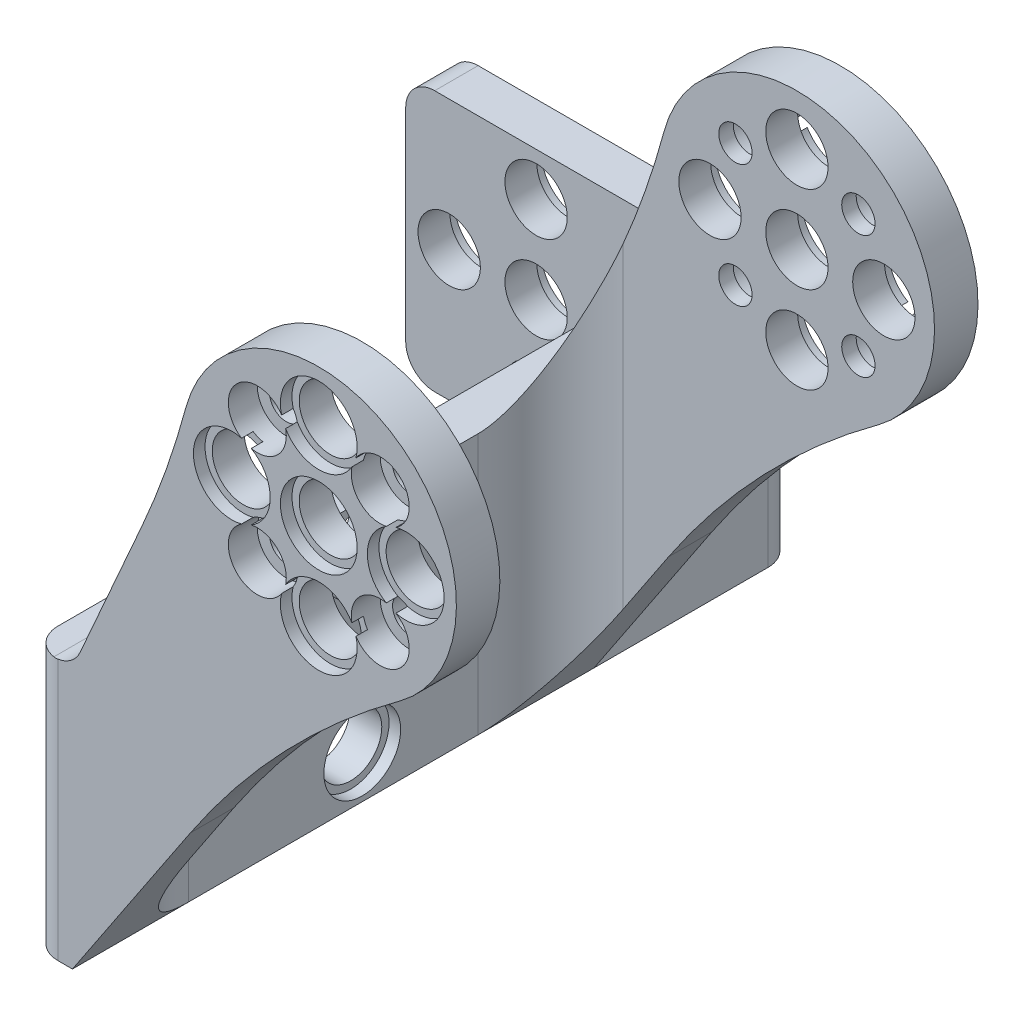
from build123d import *

# Parameters (mm, degrees)
SKETCH1_R                                            = 2
BOSS_EXTRUDE1_DEPTH                                  = 3
SKETCH23_R                                           = 2.15
CUT_EXTRUDE5_DEPTH                                   = 41.422765863
SKETCH2_W                                            = 3
SKETCH2_H                                            = 18
BOSS_EXTRUDE2_DEPTH                                  = 44
SKETCH3_R                                            = 2.15
BOSS_EXTRUDE3_DEPTH                                  = 3
SKETCH5_R                                            = 2.65
CUT_EXTRUDE1_DEPTH                                   = 0.8
CUT_EXTRUDE2_START                                   = -0.8
SKETCH11_R                                           = 2.65
CUT_EXTRUDE2_DEPTH                                   = 0.8
SKETCH12_W                                           = 24
SKETCH12_H                                           = 18
SKETCH12_R                                           = 2
BOSS_EXTRUDE4_DEPTH                                  = 3
SKETCH24_R                                           = 2.15
CUT_EXTRUDE6_DEPTH                                   = 74.525505779
HOLE1_D                                              = 4.3
HOLE1_CBORE_D                                        = 5.3
HOLE1_CBORE_DEPTH                                    = 0.8
SKETCH22_R                                           = 2.65
CUT_EXTRUDE4_DEPTH                                   = 0.8
CBORE_FOR_M1_6_HEX_SOCKET_HEAD_CAP_SCREW_D           = 2.3
CBORE_FOR_M1_6_HEX_SOCKET_HEAD_CAP_SCREW_DEPTH       = 3
CBORE_FOR_M1_6_HEX_SOCKET_HEAD_CAP_SCREW_CBORE_D     = 4
CBORE_FOR_M1_6_HEX_SOCKET_HEAD_CAP_SCREW_CBORE_DEPTH = 2
CBORE_FOR_M1_6_HEX_SOCKET_HEAD_CAP_S_2_D             = 2.3
CBORE_FOR_M1_6_HEX_SOCKET_HEAD_CAP_S_2_CBORE_D       = 4
CBORE_FOR_M1_6_HEX_SOCKET_HEAD_CAP_S_2_CBORE_DEPTH   = 2
HOLE2_D                                              = 4.3
HOLE2_DEPTH                                          = 3
HOLE2_CBORE_D                                        = 5.3
HOLE2_CBORE_DEPTH                                    = 0.8
HOLE3_D                                              = 4.3
HOLE3_CBORE_D                                        = 5.3
HOLE3_CBORE_DEPTH                                    = 0.8
FILLET10_R                                           = 2
FILLET5_R                                            = 2
CHAMFER2_SIZE                                        = 2
FILLET7_R                                            = 60
REDONDEO1_R                                          = 5


with BuildPart() as part:
    # Sketch1 → Boss-Extrude1 (new body)
    with BuildSketch(Plane.XY):
        with BuildLine():
            Line((0, -9.5), (-17, -35))
            Line((-17, -35), (-20, -35))
            Line((-20, -35), (-20, -17))
            Line((-20, -17), (-17, -17))
            Line((-17, -17), (-9.5, 0))
            ThreePointArc((-9.5, 0), (6.717514421, 6.717514421), (0, -9.5))
        make_face()
        with Locations((-6, 0)):
            Circle(SKETCH1_R, mode=Mode.SUBTRACT)
        with Locations((0, -6)):
            Circle(SKETCH1_R, mode=Mode.SUBTRACT)
        with Locations((6, 0)):
            Circle(SKETCH1_R, mode=Mode.SUBTRACT)
        with Locations((0, 6)):
            Circle(SKETCH1_R, mode=Mode.SUBTRACT)
    extrude(amount=BOSS_EXTRUDE1_DEPTH)

    # Sketch23 → Cut-Extrude5 (cut, through all)
    with BuildSketch(Plane.XY.offset(3)):
        with Locations((6, 0)):
            Circle(SKETCH23_R)
        with Locations((0, -6)):
            Circle(SKETCH23_R)
        with Locations((-6, 0)):
            Circle(SKETCH23_R)
        with Locations((0, 6)):
            Circle(SKETCH23_R)
    extrude(amount=-CUT_EXTRUDE5_DEPTH, mode=Mode.SUBTRACT)

    # Sketch2 → Boss-Extrude2 (add)
    with BuildSketch(Plane(origin=(0, 0, 0), x_dir=(-1, 0, 0), z_dir=(0, 0, -1))):
        with Locations((18.5, -26)):
            Rectangle(SKETCH2_W, SKETCH2_H)
    extrude(amount=BOSS_EXTRUDE2_DEPTH)

    # Sketch3 → Boss-Extrude3 (add)
    with BuildSketch(Plane(origin=(0, 0, -30), x_dir=(-1, 0, 0), z_dir=(0, 0, -1))):
        with BuildLine():
            Line((20, -17), (17, -17))
            Line((17, -17), (9.5, 0))
            ThreePointArc((9.5, 0), (-6.717514421, 6.717514421), (0, -9.5))
            Line((0, -9.5), (17, -35))
            Line((17, -35), (20, -35))
            Line((20, -35), (20, -17))
        make_face()
        with Locations(Location((0, -6, 0), (0, 0, 180))):
            Circle(SKETCH3_R, mode=Mode.SUBTRACT)
        with Locations(Location((-6, 0, 0), (0, 0, 180))):
            Circle(SKETCH3_R, mode=Mode.SUBTRACT)
        with Locations(Location((6, 0, 0), (0, 0, 180))):
            Circle(SKETCH3_R, mode=Mode.SUBTRACT)
        with Locations(Location((0, 6, 0), (0, 0, 180))):
            Circle(SKETCH3_R, mode=Mode.SUBTRACT)
    extrude(amount=BOSS_EXTRUDE3_DEPTH)

    # Sketch5 → Cut-Extrude1 (cut)
    with BuildSketch(Plane.XY.offset(3)):
        with Locations((0, -6)):
            Circle(SKETCH5_R)
        with Locations((-6, 0)):
            Circle(SKETCH5_R)
        with Locations((0, 6)):
            Circle(SKETCH5_R)
        with Locations((6, 0)):
            Circle(SKETCH5_R)
    extrude(amount=-CUT_EXTRUDE1_DEPTH, mode=Mode.SUBTRACT)

    # Sketch11 → Cut-Extrude2 (cut)
    with BuildSketch(Plane(origin=(0, 0, -33), x_dir=(-1, 0, 0), z_dir=(0, 0, -1)).offset(CUT_EXTRUDE2_START)):
        with Locations(Location((0, 6, 0), (0, 0, 180))):
            Circle(SKETCH11_R)
        with Locations(Location((-6, 0, 0), (0, 0, 180))):
            Circle(SKETCH11_R)
        with Locations(Location((0, -6, 0), (0, 0, 180))):
            Circle(SKETCH11_R)
        with Locations(Location((6, 0, 0), (0, 0, 180))):
            Circle(SKETCH11_R)
    extrude(amount=CUT_EXTRUDE2_DEPTH, mode=Mode.SUBTRACT)

    # Sketch12 → Boss-Extrude4 (add)
    with BuildSketch(Plane(origin=(0, 0, -44), x_dir=(-1, 0, 0), z_dir=(0, 0, -1))):
        with Locations((29, -26)):
            Rectangle(SKETCH12_W, SKETCH12_H)
        with Locations((38, -26)):
            Circle(SKETCH12_R, mode=Mode.SUBTRACT)
        with Locations((32, -32)):
            Circle(SKETCH12_R, mode=Mode.SUBTRACT)
        with Locations((32, -26)):
            Circle(SKETCH12_R, mode=Mode.SUBTRACT)
        with Locations((32, -20)):
            Circle(SKETCH12_R, mode=Mode.SUBTRACT)
        with Locations((26, -26)):
            Circle(SKETCH12_R, mode=Mode.SUBTRACT)
    extrude(amount=BOSS_EXTRUDE4_DEPTH)

    # Sketch24 → Cut-Extrude6 (cut, through all)
    with BuildSketch(Plane(origin=(0, 0, -47), x_dir=(-1, 0, 0), z_dir=(0, 0, -1))):
        with Locations((32, -20)):
            Circle(SKETCH24_R)
        with Locations((26, -26)):
            Circle(SKETCH24_R)
        with Locations((32, -26)):
            Circle(SKETCH24_R)
        with Locations((38, -26)):
            Circle(SKETCH24_R)
        with Locations((32, -32)):
            Circle(SKETCH24_R)
    extrude(amount=-CUT_EXTRUDE6_DEPTH, mode=Mode.SUBTRACT)

    # Hole1 (through all)
    with Locations(Plane(origin=(-17, 0, 0), x_dir=(0, 0, -1), z_dir=(1, 0, 0))):
        with Locations((17, -20), (17, -32)):
            CounterBoreHole(HOLE1_D / 2, HOLE1_CBORE_D / 2, HOLE1_CBORE_DEPTH)

    # Sketch22 → Cut-Extrude4 (cut)
    with BuildSketch(Plane(origin=(0, 0, -47), x_dir=(-1, 0, 0), z_dir=(0, 0, -1))):
        with Locations((32, -32)):
            Circle(SKETCH22_R)
        with Locations((38, -26)):
            Circle(SKETCH22_R)
        with Locations((32, -26)):
            Circle(SKETCH22_R)
        with Locations((32, -20)):
            Circle(SKETCH22_R)
        with Locations((26, -26)):
            Circle(SKETCH22_R)
    extrude(amount=-CUT_EXTRUDE4_DEPTH, mode=Mode.SUBTRACT)

    # CBORE for M1.6 Hex Socket Head Cap Screw
    with Locations(Plane.XY.offset(3)):
        with Locations((-4.242640687, -4.242640687), (4.242640687, -4.242640687), (4.242640687, 4.242640687), (-4.242640687, 4.242640687)):
            CounterBoreHole(CBORE_FOR_M1_6_HEX_SOCKET_HEAD_CAP_SCREW_D / 2, CBORE_FOR_M1_6_HEX_SOCKET_HEAD_CAP_SCREW_CBORE_D / 2, CBORE_FOR_M1_6_HEX_SOCKET_HEAD_CAP_SCREW_CBORE_DEPTH, depth=CBORE_FOR_M1_6_HEX_SOCKET_HEAD_CAP_SCREW_DEPTH)

    # CBORE for M1.6 Hex Socket Head Cap S 2 (through all)
    with Locations(Plane(origin=(0, 0, -33), x_dir=(-1, 0, 0), z_dir=(0, 0, -1))):
        with Locations((4.242640687, 4.242640687), (4.242640687, -4.242640687), (-4.242640687, -4.242640687), (-4.242640687, 4.242640687)):
            CounterBoreHole(CBORE_FOR_M1_6_HEX_SOCKET_HEAD_CAP_S_2_D / 2, CBORE_FOR_M1_6_HEX_SOCKET_HEAD_CAP_S_2_CBORE_D / 2, CBORE_FOR_M1_6_HEX_SOCKET_HEAD_CAP_S_2_CBORE_DEPTH)

    # Hole2
    with Locations(Plane.XY.offset(3)):
        with Locations((0, 0)):
            CounterBoreHole(HOLE2_D / 2, HOLE2_CBORE_D / 2, HOLE2_CBORE_DEPTH, depth=HOLE2_DEPTH)

    # Hole3 (through all)
    with Locations(Plane(origin=(0, 0, -33), x_dir=(-1, 0, 0), z_dir=(0, 0, -1))):
        with Locations((0, 0)):
            CounterBoreHole(HOLE3_D / 2, HOLE3_CBORE_D / 2, HOLE3_CBORE_DEPTH)

    # Fillet10
    fillet10_edges = [part.edges().sort_by_distance(p)[0] for p in [
        (-17, -17, 1.5),
    ]]
    fillet(fillet10_edges, radius=FILLET10_R)

    # Fillet5
    fillet5_edges = [part.edges().sort_by_distance(p)[0] for p in [
        (-41, -17, -45.5),
        (-41, -35, -45.5),
        (-17, -26, -47),
        (-20, -26, 3),
    ]]
    fillet(fillet5_edges, radius=FILLET5_R)

    # Chamfer2
    chamfer2_edges = [part.edges().sort_by_distance(p)[0] for p in [
        (-20, -26, -44),
    ]]
    chamfer(chamfer2_edges, length=CHAMFER2_SIZE)

    # Fillet7
    fillet7_edges = [part.edges().sort_by_distance(p)[0] for p in [
        (0, -9.5, 1.5),
        (-9.5, 0, 1.5),
        (-9.5, 0, -31.5),
        (0, -9.5, -31.5),
    ]]
    fillet(fillet7_edges, radius=FILLET7_R)

    # Redondeo1
    # the kernel refuses this fillet: 5 mm, written as the material it adds along each edge
    with BuildSketch(Plane(origin=(-17, -47.5, -30), x_dir=(0, 0, 1), z_dir=(0, 1, 0))) as redondeo1_piece_1_section:
        with BuildLine():
            CenterArc((REDONDEO1_R, REDONDEO1_R), REDONDEO1_R, 180, 90)
            Line((0, REDONDEO1_R), (0, 0))
            Line((0, 0), (REDONDEO1_R, 0))
        make_face()
    redondeo1_piece_1 = extrude(amount=43, mode=Mode.PRIVATE)
    redondeo1_piece_1 = split(redondeo1_piece_1, bisect_by=Plane(origin=(-12.168719693, -27.753079539, -28.835648112), z_dir=(-0.8320502943378423, 0.5547001962252313, 0)), keep=Keep.TOP, mode=Mode.PRIVATE)
    redondeo1_piece_1 = split(redondeo1_piece_1, bisect_by=Plane(origin=(-19.867910191, -23.500596432, -28.835648112), z_dir=(0.9149178015729305, -0.40364020657629746, 0)), keep=Keep.TOP, mode=Mode.PRIVATE)
    add(redondeo1_piece_1)
    with BuildSketch(Plane(origin=(-17, -47.5, 0), x_dir=(1, 0, 0), z_dir=(0, 1, 0))) as redondeo1_piece_2_section:
        with BuildLine():
            CenterArc((REDONDEO1_R, REDONDEO1_R), REDONDEO1_R, 180, 90)
            Line((0, REDONDEO1_R), (0, 0))
            Line((0, 0), (REDONDEO1_R, 0))
        make_face()
    redondeo1_piece_2 = extrude(amount=30.5, mode=Mode.PRIVATE)
    redondeo1_piece_2 = split(redondeo1_piece_2, bisect_by=Plane(origin=(-12.168719693, -27.753079539, -1.164351888), z_dir=(-0.8320502943378424, 0.5547001962252313, 0)), keep=Keep.TOP, mode=Mode.PRIVATE)
    add(redondeo1_piece_2)


solid = part.part
